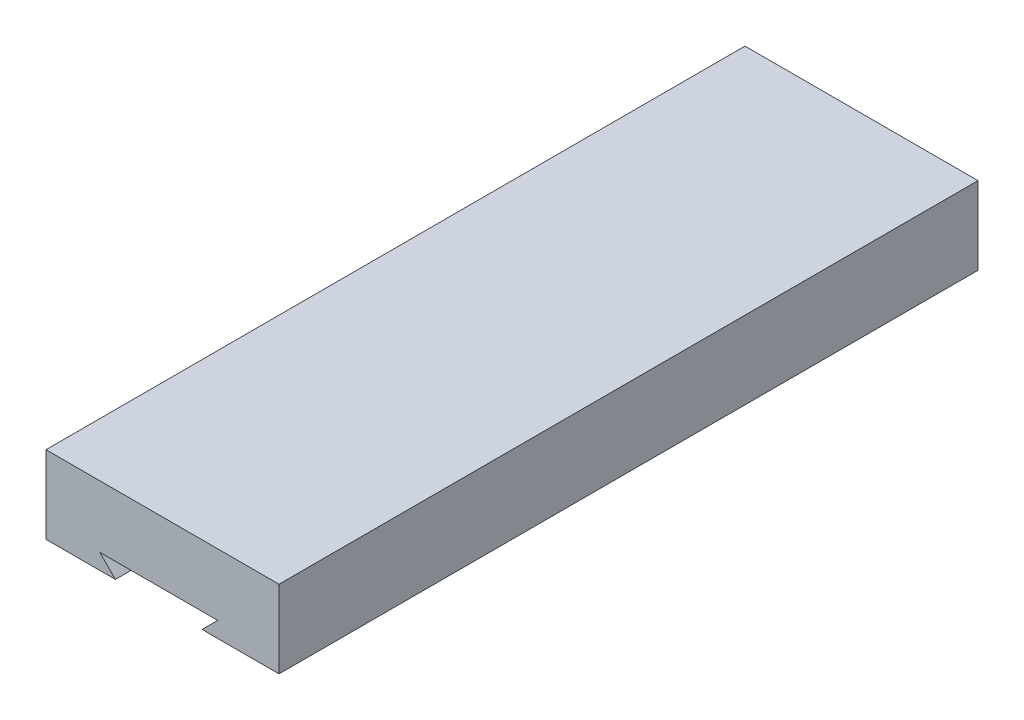
from build123d import *

# Parameters (mm, degrees)
SKETCH1_W               = 60
SKETCH1_H               = 20
BOSS_EXTRUDE1_DEPTH     = 180
CUT_EXTRUDE1_DEPTH      = 185.200802005
CUT_EXTRUDE1_DEPTH_BACK = 180


with BuildPart() as part:
    # Sketch1 → Boss-Extrude1 (new body)
    with BuildSketch(Plane.XY):
        with Locations((-1.021069692, 13.824959481)):
            Rectangle(SKETCH1_W, SKETCH1_H)
    extrude(amount=BOSS_EXTRUDE1_DEPTH)

    # Sketch2 → Cut-Extrude1 (cut, two sides: drawn at the far end of the back side and taken through both)
    with BuildSketch(Plane.XY.offset(180).offset(-CUT_EXTRUDE1_DEPTH_BACK)):
        Polygon((-13.144766463, 3.824959481), (-17.18054141, 7.860734428), (13.187901915, 7.860734428), (9.152126968, 3.824959481), align=None)
    extrude(amount=CUT_EXTRUDE1_DEPTH + CUT_EXTRUDE1_DEPTH_BACK, mode=Mode.SUBTRACT)


solid = part.part
